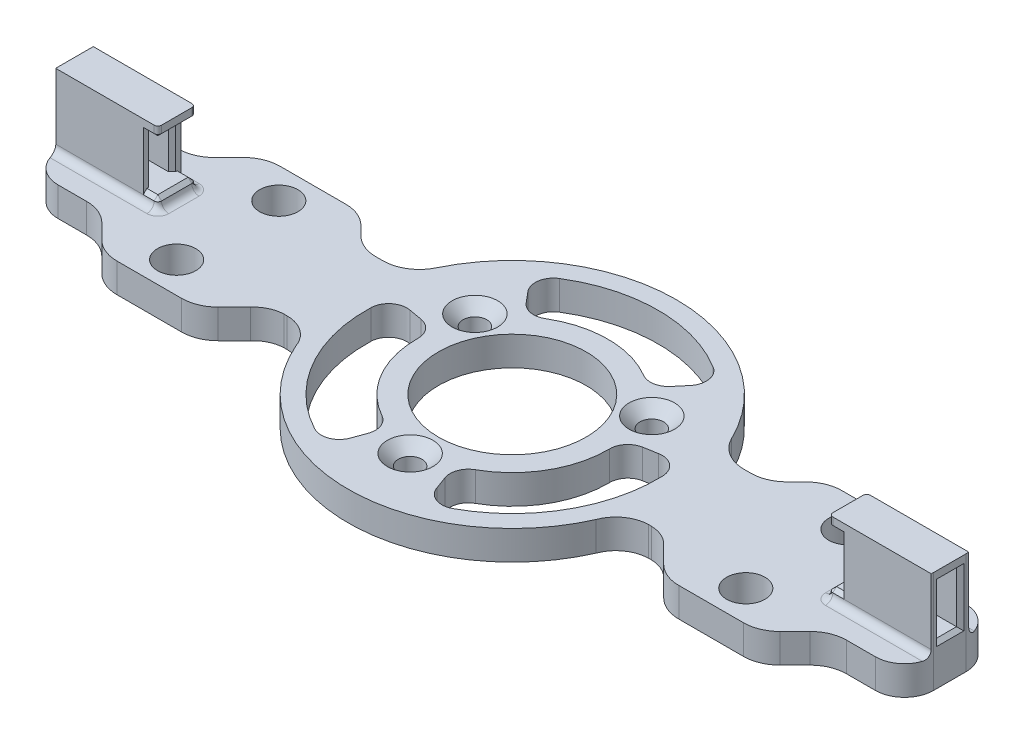
from build123d import *

# Parameters (mm, degrees)
SKETCH1_R               = 10.125
SKETCH1_R_2             = 1.625
SKETCH1_R_3             = 2.625
BOSS_EXTRUDE1_DEPTH     = 4
CHAMFER1_SIZE           = 1.5
SKETCH3_W               = 14
SKETCH3_H               = 5.15
BOSS_EXTRUDE3_DEPTH     = 10
CUT_EXTRUDE1_REACH      = 124.891
SKETCH5_W               = 2.75
SKETCH5_H               = 7
SKETCH6_W               = 2
SKETCH6_H               = 7
CUT_EXTRUDE2_DEPTH      = 67.518836618
FILLET2_R               = 0.5
FILLET3_R               = 1
CUT_EXTRUDE3_DEPTH      = 10
FILLET4_R               = 5
FILLET6_R               = 4
MIRROR2_DEPTH           = 14
FILLET7_R               = 5
FILLET2_OF_MIRROR6_R    = 0.5
FILLET3_OF_MIRROR6_R    = 1
CUT_EXTRUDE4_DEPTH      = 65.855608963
CUT_EXTRUDE4_DEPTH_BACK = 65.855608963
FILLET8_R               = 5
FILLET9_R               = 4
CHAMFER3_SIZE           = 0.5


# Read off the part's stored shape, not the designer's step: Mirror2
with BuildPart() as part:
    # Sketch1 → Boss-Extrude1 (new body)
    with BuildSketch(Plane(origin=(0, 0, 0), x_dir=(1, 0, 0), z_dir=(0, 1, 0))):
        with BuildLine():
            Line((-33.994474399, 11.175394139), (-39, 11.175394139))
            Line((-39, 11.175394139), (-60, 11.175394139))
            Line((-60, 11.175394139), (-60, -11.251987552))
            Line((-60, -11.251987552), (-39, -11.251987552))
            Line((-39, -11.251987552), (-34.071067812, -11.251987552))
            ThreePointArc((-34.071067812, -11.251987552), (-32.15765065, -10.871385214), (-30.535533906, -9.787521458))
            Line((-30.535533906, -9.787521458), (-28.313936139, -7.565923691))
            ThreePointArc((-28.313936139, -7.565923691), (-26.887697685, -6.508651832), (-25.159643066, -6.101457597))
            Line((-25.159643066, -6.101457597), (-24.760034307, -6.101457597))
            ThreePointArc((-24.760034307, -6.101457597), (-22.194921551, -6.923374854), (-20.585162509, -9.083010761))
            ThreePointArc((-20.585162509, -9.083010761), (-20.064123568, -10.182384075), (-19.484423936, -11.251987552))
            ThreePointArc((-19.484423936, -11.251987552), (1.21615025, -22.467108816), (20.585162509, -9.083010761))
            ThreePointArc((20.585162509, -9.083010761), (22.216290811, -6.953296816), (24.760034307, -6.101457597))
            Line((24.760034307, -6.101457597), (25.159643066, -6.101457597))
            ThreePointArc((25.159643066, -6.101457597), (26.890244586, -6.503166098), (28.313936139, -7.565923691))
            Line((28.313936139, -7.565923691), (30.535533906, -9.787521458))
            ThreePointArc((30.535533906, -9.787521458), (32.15765065, -10.871385214), (34.071067812, -11.251987552))
            Line((34.071067812, -11.251987552), (39, -11.251987552))
            Line((39, -11.251987552), (60, -11.251987552))
            Line((60, -11.251987552), (60, 11.175394139))
            Line((60, 11.175394139), (39, 11.175394139))
            Line((39, 11.175394139), (33.994474399, 11.175394139))
            ThreePointArc((33.994474399, 11.175394139), (32.081057237, 10.794791802), (30.458940493, 9.710928045))
            Line((30.458940493, 9.710928045), (29.212478542, 8.464466094))
            ThreePointArc((29.212478542, 8.464466094), (27.590361798, 7.380602337), (25.676944636, 7))
            Line((25.676944636, 7), (24.743686063, 7))
            ThreePointArc((24.743686063, 7), (22.08935855, 7.762719569), (20.244834052, 9.818181818))
            ThreePointArc((20.244834052, 9.818181818), (0.811483584, 22.48536178), (-19.484423936, 11.251987552))
            ThreePointArc((-19.484423936, 11.251987552), (-19.877561088, 10.541943142), (-20.244834052, 9.818181818))
            ThreePointArc((-20.244834052, 9.818181818), (-22.08935855, 7.762719569), (-24.743686063, 7))
            Line((-24.743686063, 7), (-25.676944636, 7))
            ThreePointArc((-25.676944636, 7), (-27.590361798, 7.380602337), (-29.212478542, 8.464466094))
            Line((-29.212478542, 8.464466094), (-30.458940493, 9.710928045))
            ThreePointArc((-30.458940493, 9.710928045), (-32.081057237, 10.794791802), (-33.994474399, 11.175394139))
        make_face()
        with Locations(Location((0, 0, 0), (0, 0, 270))):
            Circle(SKETCH1_R, mode=Mode.SUBTRACT)
        with Locations(Location((-12.124355653, 7, 0), (0, 0, 270))):
            Circle(SKETCH1_R_2, mode=Mode.SUBTRACT)
        with Locations(Location((12.124355653, 7, 0), (0, 0, 270))):
            Circle(SKETCH1_R_2, mode=Mode.SUBTRACT)
        with Locations(Location((0, -14, 0), (0, 0, 270))):
            Circle(SKETCH1_R_2, mode=Mode.SUBTRACT)
        with Locations(Location((-39, 7, 0), (0, 0, 270))):
            Circle(SKETCH1_R_3, mode=Mode.SUBTRACT)
        with Locations(Location((-39, -7, 0), (0, 0, 270))):
            Circle(SKETCH1_R_3, mode=Mode.SUBTRACT)
        with Locations(Location((39, -7, 0), (0, 0, 90))):
            Circle(SKETCH1_R_3, mode=Mode.SUBTRACT)
        with Locations(Location((39, 7, 0), (0, 0, 90))):
            Circle(SKETCH1_R_3, mode=Mode.SUBTRACT)
        with BuildLine():
            Line((-5.27521723, -14.493540222), (-5.923962655, -16.275953627))
            ThreePointArc((-5.923962655, -16.275953627), (-7.381618464, -17.756517255), (-9.455079093, -17.62388945))
            ThreePointArc((-9.455079093, -17.62388945), (-17.320508076, -10), (-19.990275524, 0.623606036))
            ThreePointArc((-19.990275524, 0.623606036), (-19.068404258, 2.485589517), (-17.057370639, 3.007674664))
            Line((-17.057370639, 3.007674664), (-15.189382638, 2.678297979))
            ThreePointArc((-15.189382638, 2.678297979), (-13.697315881, 1.809954494), (-13.123742589, 0.181674021))
            ThreePointArc((-13.123742589, 0.181674021), (-11.366583425, -6.5625), (-6.404536977, -11.456331486))
            ThreePointArc((-6.404536977, -11.456331486), (-5.281191369, -12.767200763), (-5.27521723, -14.493540222))
        make_face(mode=Mode.SUBTRACT)
        with BuildLine():
            Line((-9.914165408, 11.815242243), (-11.133407985, 13.268278963))
            ThreePointArc((-11.133407985, 13.268278963), (-11.686785794, 15.270927738), (-10.535196431, 17.000283414))
            ThreePointArc((-10.535196431, 17.000283414), (0, 20), (10.535196431, 17.000283414))
            ThreePointArc((10.535196431, 17.000283414), (11.686785794, 15.270927738), (11.133407985, 13.268278963))
            Line((11.133407985, 13.268278963), (9.914165408, 11.815242243))
            ThreePointArc((9.914165408, 11.815242243), (8.416124512, 10.95724627), (6.719205612, 11.274657464))
            ThreePointArc((6.719205612, 11.274657464), (0, 13.125), (-6.719205612, 11.274657464))
            ThreePointArc((-6.719205612, 11.274657464), (-8.416124512, 10.95724627), (-9.914165408, 11.815242243))
        make_face(mode=Mode.SUBTRACT)
        with BuildLine():
            Line((15.189382638, 2.678297979), (17.057370639, 3.007674664))
            ThreePointArc((17.057370639, 3.007674664), (19.068404258, 2.485589517), (19.990275524, 0.623606036))
            ThreePointArc((19.990275524, 0.623606036), (17.320508076, -10), (9.455079093, -17.62388945))
            ThreePointArc((9.455079093, -17.62388945), (7.381618464, -17.756517255), (5.923962655, -16.275953627))
            Line((5.923962655, -16.275953627), (5.27521723, -14.493540222))
            ThreePointArc((5.27521723, -14.493540222), (5.281191369, -12.767200763), (6.404536977, -11.456331486))
            ThreePointArc((6.404536977, -11.456331486), (11.366583425, -6.5625), (13.123742589, 0.181674021))
            ThreePointArc((13.123742589, 0.181674021), (13.697315881, 1.809954494), (15.189382638, 2.678297979))
        make_face(mode=Mode.SUBTRACT)
    extrude(amount=BOSS_EXTRUDE1_DEPTH)

    # Chamfer1
    chamfer1_edges = [part.edges().sort_by_distance(p)[0] for p in [
        (-12.124355653, 4, -8.625),
        (12.124355653, 4, -8.625),
        (0, 4, 12.375),
    ]]
    chamfer(chamfer1_edges, length=CHAMFER1_SIZE)

    # Sketch3 → Boss-Extrude3 (add)
    with BuildSketch(Plane(origin=(0, 4, 0), x_dir=(1, 0, 0), z_dir=(0, 1, 0))):
        with Locations((-53, 0)):
            Rectangle(SKETCH3_W, SKETCH3_H)
    boss_extrude3 = extrude(amount=BOSS_EXTRUDE3_DEPTH)

    # Sketch5 → Cut-Extrude1 (cut, up to next)
    with BuildSketch(Plane.ZY.offset(60), mode=Mode.PRIVATE) as cut_extrude1_sk1:
        with Locations((0, 9)):
            Rectangle(SKETCH5_W, SKETCH5_H)
    cut_extrude1_tool1 = extrude(cut_extrude1_sk1.sketch, amount=-CUT_EXTRUDE1_REACH, mode=Mode.PRIVATE) & part.part
    cut_extrude1 = cut_extrude1_tool1.solids().sort_by_distance((-60, 9, 0))[0]
    add(cut_extrude1, mode=Mode.SUBTRACT)

    # Sketch6 → Cut-Extrude2 (cut, through all)
    with BuildSketch(Plane.XY.offset(2.575)):
        with Locations((-47, 9)):
            Rectangle(SKETCH6_W, SKETCH6_H)
    cut_extrude2 = extrude(amount=-CUT_EXTRUDE2_DEPTH, mode=Mode.SUBTRACT)

    # Fillet2
    fillet2_edges = [part.edges().sort_by_distance(p)[0] for p in [
        (-46, 13.25, 2.575),
        (-46, 13.25, -2.575),
        (-46, 4.75, -2.575),
        (-46, 4.75, 2.575),
    ]]
    fillet(fillet2_edges, radius=FILLET2_R)

    # Fillet3
    fillet3_edges = [part.edges().sort_by_distance(p)[0] for p in [
        (-53.25, 4, 2.575),
        (-46, 4, 0),
        (-53.25, 4, -2.575),
        (-46.146446609, 4, 2.428553391),
        (-46.146446609, 4, -2.428553391),
    ]]
    fillet(fillet3_edges, radius=FILLET3_R)

    # Sketch8 → Cut-Extrude3 (cut)
    with BuildSketch(Plane(origin=(0, 4, 0), x_dir=(1, 0, 0), z_dir=(0, 1, 0))):
        Polygon((-45, -11.251987552), (-50, -6.251987552), (-60, -6.251987552), (-60, -11.251987552), align=None)
    cut_extrude3 = extrude(amount=-CUT_EXTRUDE3_DEPTH, mode=Mode.SUBTRACT)

    # Fillet4
    fillet4_edges = [part.edges().sort_by_distance(p)[0] for p in [
        (-45, 2, 11.251987552),
        (-50, 2, 6.251987552),
    ]]
    fillet(fillet4_edges, radius=FILLET4_R)

    # Fillet6
    fillet6_edges = [part.edges().sort_by_distance(p)[0] for p in [
        (-60, 2, 6.251987552),
    ]]
    fillet(fillet6_edges, radius=FILLET6_R)

    # Mirror2 outline → Mirror2 (cut)
    with BuildSketch(Plane(origin=(0, 0, 0), x_dir=(1, 0, 0), z_dir=(0, 1, 0))):
        with BuildLine():
            Line((-48.535533906, 7.716453646), (-45.076593413, 11.175394139))
            Line((-45.076593413, 11.175394139), (-60, 11.175394139))
            Line((-60, 11.175394139), (-60, 2.251987552))
            ThreePointArc((-60, 2.251987552), (-58.828427125, 5.080414677), (-56, 6.251987552))
            Line((-56, 6.251987552), (-52.071067812, 6.251987552))
            ThreePointArc((-52.071067812, 6.251987552), (-50.15765065, 6.632589889), (-48.535533906, 7.716453646))
        make_face()
    extrude(amount=MIRROR2_DEPTH, mode=Mode.SUBTRACT)

    # Fillet7
    fillet7_edges = [part.edges().sort_by_distance(p)[0] for p in [
        (-45.076593413, 2, -11.175394139),
    ]]
    fillet(fillet7_edges, radius=FILLET7_R)

    # Mirror6: Boss-Extrude3, Cut-Extrude1, Cut-Extrude2, Cut-Extrude3 across plane
    add(boss_extrude3.mirror(Plane(origin=(0, 0, 0), x_dir=(0, 0, 1), z_dir=(1, 0, 0))))
    add(cut_extrude1.mirror(Plane(origin=(0, 0, 0), x_dir=(0, 0, 1), z_dir=(1, 0, 0))), mode=Mode.SUBTRACT)
    add(cut_extrude2.mirror(Plane(origin=(0, 0, 0), x_dir=(0, 0, 1), z_dir=(1, 0, 0))), mode=Mode.SUBTRACT)
    add(cut_extrude3.mirror(Plane(origin=(0, 0, 0), x_dir=(0, 0, 1), z_dir=(1, 0, 0))), mode=Mode.SUBTRACT)

    # Fillet2 of Mirror6
    fillet2_of_mirror6_edges = [part.edges().sort_by_distance(p)[0] for p in [
        (46, 13.25, 2.575),
        (46, 13.25, -2.575),
        (46, 4.75, -2.575),
        (46, 4.75, 2.575),
    ]]
    fillet(fillet2_of_mirror6_edges, radius=FILLET2_OF_MIRROR6_R)

    # Fillet3 of Mirror6
    fillet3_of_mirror6_edges = [part.edges().sort_by_distance(p)[0] for p in [
        (53.25, 4, 2.575),
        (46, 4, 0),
        (53.25, 4, -2.575),
        (46.146446609, 4, 2.428553391),
        (46.146446609, 4, -2.428553391),
    ]]
    fillet(fillet3_of_mirror6_edges, radius=FILLET3_OF_MIRROR6_R)

    # Sketch9 → Cut-Extrude4 (cut, two sides: drawn at the far end of the back side and taken through both)
    with BuildSketch(Plane(origin=(0, 4, 0), x_dir=(1, 0, 0), z_dir=(0, 1, 0)).offset(-CUT_EXTRUDE4_DEPTH_BACK)):
        Polygon((-136.554753313, 192.730147452), (45, 11.175394139), (50, 6.175394139), (60, 6.175394139), (316.757194449, 6.175394139), (512.185341039, 481.048921643), (58.873393278, 667.603674956), align=None)
    extrude(amount=CUT_EXTRUDE4_DEPTH + CUT_EXTRUDE4_DEPTH_BACK, mode=Mode.SUBTRACT)

    # Fillet8
    fillet8_edges = [part.edges().sort_by_distance(p)[0] for p in [
        (45, 2, 11.251987552),
        (50, 2, 6.251987552),
        (45, 2, -11.175394139),
        (50, 2, -6.175394139),
    ]]
    fillet(fillet8_edges, radius=FILLET8_R)

    # Fillet9
    fillet9_edges = [part.edges().sort_by_distance(p)[0] for p in [
        (60, 2, 6.251987552),
        (60, 2, -6.175394139),
    ]]
    fillet(fillet9_edges, radius=FILLET9_R)

    # Chamfer3
    chamfer3_edges = [part.edges().sort_by_distance(p)[0] for p in [
        (-60, 9, -1.375),
        (-60, 5.5, 0),
        (-60, 9, 1.375),
        (-60, 12.5, 0),
        (-47.25, 5.5, -2.575),
        (-48, 9, -1.375),
        (-48, 9, 1.375),
        (-47.25, 5.5, 2.575),
        (-46, 5.5, 0),
        (-47.25, 12.5, 2.575),
        (-46.146446609, 5.5, -2.428553391),
        (-46.146446609, 5.5, 2.428553391),
        (-47.25, 12.5, -2.575),
        (-46, 12.5, 0),
        (-46.146446609, 12.5, 2.428553391),
        (-46.146446609, 12.5, -2.428553391),
        (60, 9, -1.375),
        (60, 5.5, 0),
        (60, 9, 1.375),
        (60, 12.5, 0),
        (47.25, 12.5, -2.575),
        (48, 9, -1.375),
        (48, 9, 1.375),
        (47.25, 5.5, 2.575),
        (47.25, 12.5, 2.575),
        (46, 5.5, 0),
        (47.25, 5.5, -2.575),
        (46.146446609, 5.5, -2.428553391),
        (46.146446609, 5.5, 2.428553391),
        (46, 12.5, 0),
        (46.146446609, 12.5, 2.428553391),
        (46.146446609, 12.5, -2.428553391),
    ]]
    chamfer(chamfer3_edges, length=CHAMFER3_SIZE - 0.0001)  # a hair under: the kernel refuses the full size


solid = part.part
